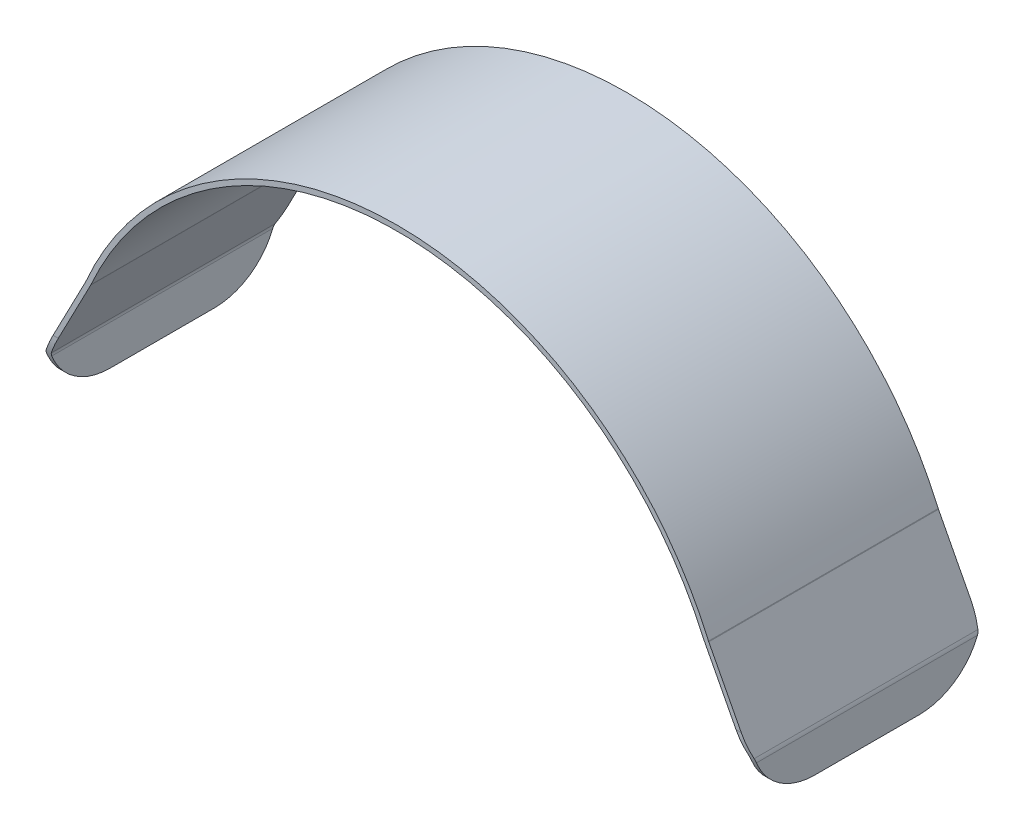
from build123d import *

# Parameters (mm, degrees)
BOSS_EXTRUDE1_DEPTH = 69.85
FILLET1_R           = 38.1
FILLET2_R           = 38.1
FILLET3_R           = 38.1
FILLET4_R           = 38.1
FILLET5_R           = 5.08
FILLET6_R           = 5.08


with BuildPart() as part:
    # Sketch2 → Boss-Extrude1 (new, symmetric)
    with BuildSketch(Plane.XY):
        with BuildLine():
            Line((-212.725, 0), (-215.9, 0))
            Line((-215.9, 0), (-215.9, 25.4))
            Line((-215.9, 25.4), (-189.455193832, 76.2))
            ThreePointArc((-189.455193832, 76.2), (0, 200.810907661), (189.455193832, 76.2))
            Line((189.455193832, 76.2), (215.9, 25.4))
            Line((215.9, 25.4), (215.9, 0))
            Line((215.9, 0), (212.725, 0))
            Line((212.725, 0), (212.725, 25.4))
            Line((212.725, 25.4), (186.280193832, 76.2))
            ThreePointArc((186.280193832, 76.2), (0, 197.635907661), (-186.280193832, 76.2))
            Line((-186.280193832, 76.2), (-212.725, 25.4))
            Line((-212.725, 25.4), (-212.725, 0))
        make_face()
    extrude(amount=BOSS_EXTRUDE1_DEPTH, both=True)

    # Fillet1
    # the kernel refuses this fillet: 38.1 mm, written as the material it takes off along each edge
    with BuildSketch(Plane(origin=(311.15, 0, -69.85), x_dir=(0, 1, 0), z_dir=(-1, 0, 0))) as fillet1_piece_1:
        with BuildLine():
            CenterArc((FILLET1_R, -FILLET1_R), FILLET1_R, 90, 90)
            Line((0, -FILLET1_R), (0, 0))
            Line((0, 0), (FILLET1_R, 0))
        make_face()
    extrude(amount=193.675, mode=Mode.SUBTRACT)

    # Fillet2
    # the kernel refuses this fillet: 38.1 mm, written as the material it takes off along each edge
    with BuildSketch(Plane(origin=(311.15, 0, 69.85), x_dir=(0, 0, -1), z_dir=(-1, 0, 0))) as fillet2_piece_1:
        with BuildLine():
            CenterArc((FILLET2_R, -FILLET2_R), FILLET2_R, 90, 90)
            Line((0, -FILLET2_R), (0, 0))
            Line((0, 0), (FILLET2_R, 0))
        make_face()
    extrude(amount=193.675, mode=Mode.SUBTRACT)

    # Fillet3
    # the kernel refuses this fillet: 38.1 mm, written as the material it takes off along each edge
    with BuildSketch(Plane(origin=(-117.475, 0, 69.85), x_dir=(0, 1, 0), z_dir=(-1, 0, 0))) as fillet3_piece_1:
        with BuildLine():
            CenterArc((FILLET3_R, FILLET3_R), FILLET3_R, 180, 90)
            Line((0, FILLET3_R), (0, 0))
            Line((0, 0), (FILLET3_R, 0))
        make_face()
    extrude(amount=193.675, mode=Mode.SUBTRACT)

    # Fillet4
    # the kernel refuses this fillet: 38.1 mm, written as the material it takes off along each edge
    with BuildSketch(Plane(origin=(-117.475, 0, -69.85), x_dir=(0, 1, 0), z_dir=(-1, 0, 0))) as fillet4_piece_1:
        with BuildLine():
            CenterArc((FILLET4_R, -FILLET4_R), FILLET4_R, 90, 90)
            Line((0, -FILLET4_R), (0, 0))
            Line((0, 0), (FILLET4_R, 0))
        make_face()
    extrude(amount=193.675, mode=Mode.SUBTRACT)

    # Fillet5
    fillet5_edges = [part.edges().sort_by_distance(p)[0] for p in [
        (215.9, 25.4, 0),
        (-215.9, 25.4, 0),
        (-212.725, 25.4, 0),
        (212.725, 25.4, 0),
    ]]
    fillet(fillet5_edges, radius=FILLET5_R)

    # Fillet6
    # the kernel refuses this fillet: 5.08 mm, written as the material it adds along each edge
    with BuildSketch(Plane(origin=(-189.455193832, 76.2, 69.85), x_dir=(0.3964547937843397, 0.9180542448490813, 0), z_dir=(0, 0, -1))) as fillet6_piece_1:
        with BuildLine():
            CenterArc((0.183763375, -5.079999508), FILLET6_R, 90.025204734, 4.118058509)
            Line((-0.183269559, -0.013276028), (0, 0))
            ThreePointArc((0, 0), (0.090764327, -1.9964e-05), (0.181528655, 0))
        make_face()
    extrude(amount=139.7)
    with BuildSketch(Plane(origin=(189.455193832, 76.2, 69.85), x_dir=(0.4617486132350293, -0.887010833178224, 0), z_dir=(0, 0, -1))) as fillet6_piece_2:
        with BuildLine():
            CenterArc((0.183749786, -5.08), FILLET6_R, 90, 4.118058509)
            ThreePointArc((-0.181054232, -0.01311555), (-0.090525673, -0.006577687), (0, 0))
            Line((0, 0), (0.183749786, 0))
        make_face()
    extrude(amount=139.7)
    # the kernel refuses this fillet: 5.08 mm, written as the material it takes off along each edge
    with BuildSketch(Plane(origin=(186.280193832, 76.2, 70.257743197), x_dir=(0.4617486132350699, -0.8870108331782028, 0), z_dir=(0, 0, -1))) as fillet6_2_piece_1:
        with BuildLine():
            CenterArc((0.163097279, -5.08), FILLET6_R, 90, 3.655257242)
            ThreePointArc((-0.160768001, -0.010334204), (-0.080382979, -0.005183004), (0, 0))
            Line((0, 0), (0.163097279, 0))
        make_face()
    extrude(amount=140.515486395, mode=Mode.SUBTRACT)
    with BuildSketch(Plane(origin=(-186.280193832, 76.2, 70.257743197), x_dir=(-0.46174861323509436, -0.8870108331781903, 0), z_dir=(0, 0, -1))) as fillet6_2_piece_2:
        with BuildLine():
            CenterArc((0.163097279, 5.08), FILLET6_R, 266.344742758, 3.655257242)
            ThreePointArc((-0.160768001, 0.010334204), (-0.080382979, 0.005183004), (0, 0))
            Line((0, 0), (0.163097279, 0))
        make_face()
    extrude(amount=140.515486395, mode=Mode.SUBTRACT)


solid = part.part
